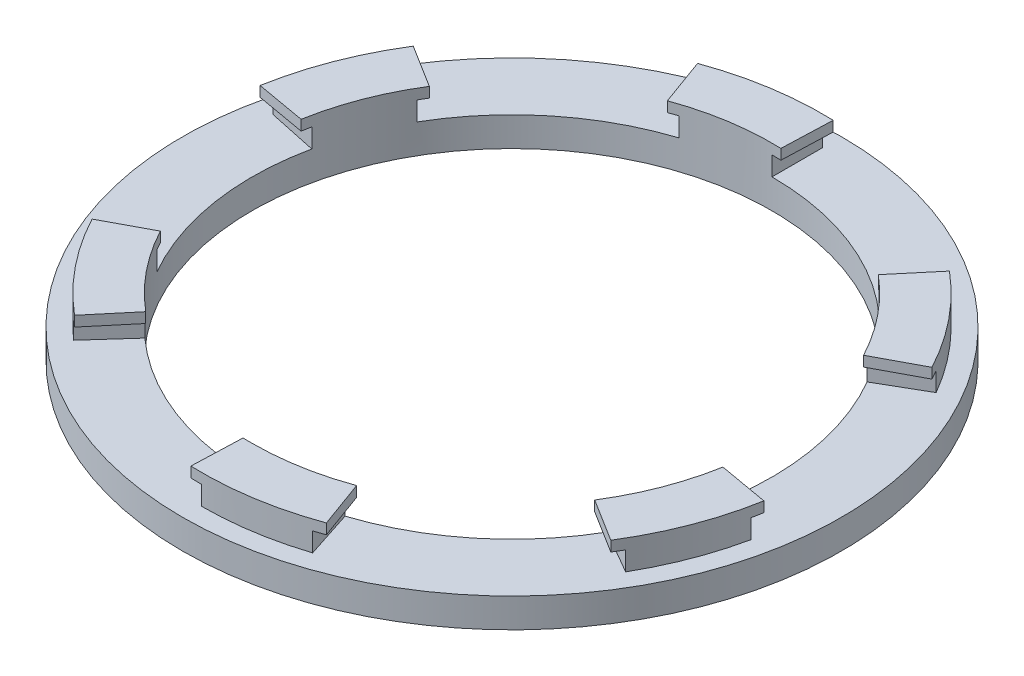
from build123d import *
from build123d.topology import SkipClean

# Parameters (mm, degrees)
SKETCH2_R           = 22.5
SKETCH2_R_2         = 17.75
BOSS_EXTRUDE1_DEPTH = 2
BOSS_EXTRUDE2_DEPTH = 2
BOSS_EXTRUDE3_START = 1.3
BOSS_EXTRUDE3_DEPTH = 0.7
CIRPATTERN1_COUNT   = 6


with BuildPart() as part:
    # Sketch2 → Boss-Extrude1 (new body)
    with BuildSketch(Plane(origin=(0, 0, 0), x_dir=(1, 0, 0), z_dir=(0, 1, 0))):
        Circle(SKETCH2_R)
        Circle(SKETCH2_R_2, mode=Mode.SUBTRACT)
    extrude(amount=BOSS_EXTRUDE1_DEPTH)

    # Sketch3 → Boss-Extrude2 (add)
    with BuildSketch(Plane(origin=(0, 2, 0), x_dir=(1, 0, 0), z_dir=(0, 1, 0))):
        with BuildLine():
            ThreePointArc((0, 21.2), (-3.316410659, 20.938992821), (-6.551160281, 20.162398145))
            Line((-6.551160281, 20.162398145), (-5.48505165, 16.881253164))
            ThreePointArc((-5.48505165, 16.881253164), (-2.776711754, 17.531468046), (0, 17.75))
            Line((0, 17.75), (0, 21.2))
        make_face()
    boss_extrude2 = extrude(amount=BOSS_EXTRUDE2_DEPTH)

    # Sketch3<4> → Boss-Extrude3 (add)
    with BuildSketch(Plane(origin=(0, 2, 0), x_dir=(1, 0, 0), z_dir=(0, 1, 0)).offset(BOSS_EXTRUDE3_START)):
        with BuildLine():
            Line((-5.48505165, 16.881253164), (-6.551160281, 20.162398145))
            ThreePointArc((-6.551160281, 20.162398145), (-6.902044874, 20.044993803), (-7.250827039, 19.921483561))
            Line((-7.250827039, 19.921483561), (-6.070857544, 16.679544019))
            ThreePointArc((-6.070857544, 16.679544019), (-5.778834742, 16.782954717), (-5.48505165, 16.881253164))
        make_face()
        with BuildLine():
            ThreePointArc((0.73986933, 21.187085533), (0.369991016, 21.196771137), (0, 21.2))
            Line((0, 21.2), (0, 17.75))
            ThreePointArc((0, 17.75), (0.309780214, 17.747296589), (0.619466066, 17.73918718))
            Line((0.619466066, 17.73918718), (0.73986933, 21.187085533))
        make_face()
    boss_extrude3 = extrude(amount=BOSS_EXTRUDE3_DEPTH)

    # CirPattern1: Boss-Extrude2, Boss-Extrude3 ×6 about axis
    with SkipClean():  # the faces are left unmerged after this step: merging them gives an invalid solid
        cirpattern1_axis = Axis((0, 2, 0), (0, -1, 0))
        add([boss_extrude2.rotate(cirpattern1_axis, i * 360 / CIRPATTERN1_COUNT) for i in range(1, CIRPATTERN1_COUNT)])
        add([boss_extrude3.rotate(cirpattern1_axis, i * 360 / CIRPATTERN1_COUNT) for i in range(1, CIRPATTERN1_COUNT)])


solid = part.part
